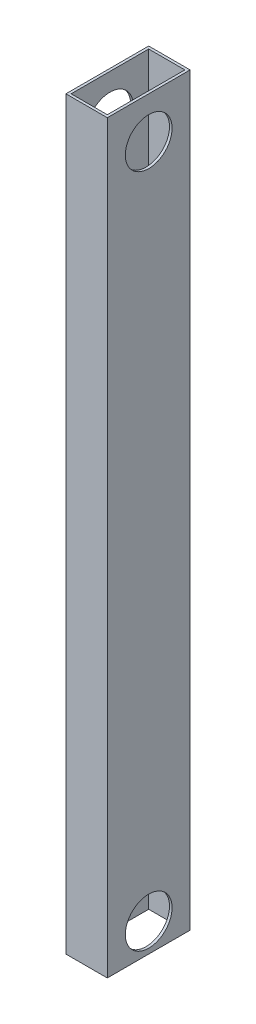
from build123d import *

# Parameters (mm, degrees)
SKETCH1_W               = 25.4
SKETCH1_H               = 50.8
SKETCH1_W_2             = 22.225
SKETCH1_H_2             = 47.625
EXTRUDE_THIN1_DEPTH     = 457.2
CUT_EXTRUDE1_DEPTH      = 461.714271539
CUT_EXTRUDE1_DEPTH_BACK = 461.714271539
SKETCH2_R               = 14.351


with BuildPart() as part:
    # Sketch1 → Extrude-Thin1 (new body)
    with BuildSketch(Plane(origin=(0, 0, 0), x_dir=(1, 0, 0), z_dir=(0, 1, 0))):
        with Locations((12.7, 25.4)):
            Rectangle(SKETCH1_W, SKETCH1_H)
        with Locations((12.7, 25.4)):
            Rectangle(SKETCH1_W_2, SKETCH1_H_2, mode=Mode.SUBTRACT)
    extrude(amount=EXTRUDE_THIN1_DEPTH)

    # Sketch2 → Cut-Extrude1 (cut, two sides: drawn at the far end of the back side and taken through both)
    with BuildSketch(Plane(origin=(25.4, 0, 0), x_dir=(0, 0, -1), z_dir=(1, 0, 0)).offset(-CUT_EXTRUDE1_DEPTH_BACK)):
        with Locations((25.4, 17.526)):
            Circle(SKETCH2_R)
        with Locations((25.4, 431.8)):
            Circle(SKETCH2_R)
    extrude(amount=CUT_EXTRUDE1_DEPTH + CUT_EXTRUDE1_DEPTH_BACK, mode=Mode.SUBTRACT)


solid = part.part
